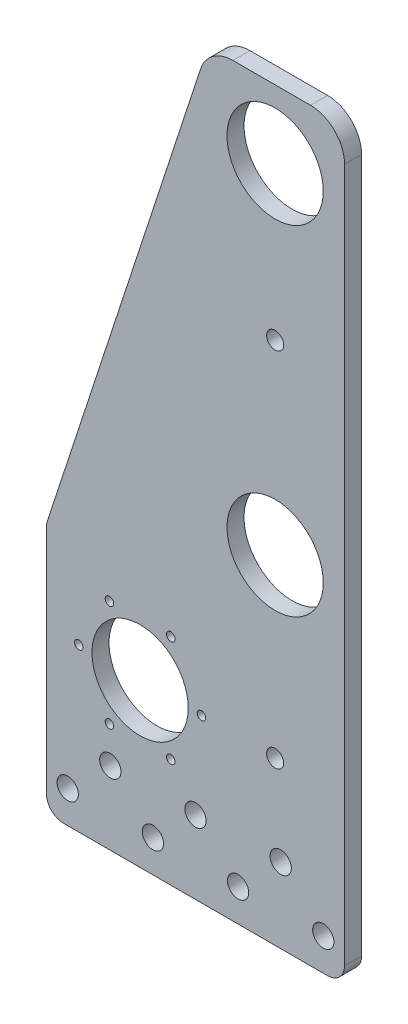
from build123d import *

# Parameters (mm, degrees)
SKETCH1_R           = 14.351
SKETCH1_R_2         = 2.54
SKETCH1_R_3         = 3.175
SKETCH1_R_4         = 1.27
BOSS_EXTRUDE1_DEPTH = 5.08


with BuildPart() as part:
    # Sketch1 → Boss-Extrude1 (new body)
    with BuildSketch(Plane.XY):
        with BuildLine():
            Line((88.9, 212.09), (88.9, 5.08))
            ThreePointArc((88.9, 5.08), (87.412102448, 1.487897552), (83.82, 0))
            Line((83.82, 0), (5.08, 0))
            ThreePointArc((5.08, 0), (1.487897552, 1.487897552), (0, 5.08))
            Line((0, 5.08), (0, 73.969993162))
            ThreePointArc((0, 73.969993162), (0.063384098, 74.769971217), (0.25195468, 75.549986324))
            Line((0.25195468, 75.549986324), (45.969223296, 215.249986324))
            ThreePointArc((45.969223296, 215.249986324), (49.662087504, 220.315906061), (55.625313935, 222.25))
            Line((55.625313935, 222.25), (78.74, 222.25))
            ThreePointArc((78.74, 222.25), (85.924204897, 219.274204897), (88.9, 212.09))
        make_face()
        with Locations((68.199, 201.93)):
            Circle(SKETCH1_R, mode=Mode.SUBTRACT)
        with Locations((68.199, 100.838)):
            Circle(SKETCH1_R, mode=Mode.SUBTRACT)
        with Locations((68.199, 156.30398)):
            Circle(SKETCH1_R_2, mode=Mode.SUBTRACT)
        with Locations((68.199, 48.35398)):
            Circle(SKETCH1_R_2, mode=Mode.SUBTRACT)
        with Locations((27.94, 48.35398)):
            Circle(SKETCH1_R, mode=Mode.SUBTRACT)
        with Locations((6.35, 9.652)):
            Circle(SKETCH1_R_3, mode=Mode.SUBTRACT)
        with Locations((31.75, 9.652)):
            Circle(SKETCH1_R_3, mode=Mode.SUBTRACT)
        with Locations((57.15, 9.652)):
            Circle(SKETCH1_R_3, mode=Mode.SUBTRACT)
        with Locations((82.55, 9.652)):
            Circle(SKETCH1_R_3, mode=Mode.SUBTRACT)
        with Locations((69.85, 22.352)):
            Circle(SKETCH1_R_3, mode=Mode.SUBTRACT)
        with Locations((44.45, 21.844)):
            Circle(SKETCH1_R_3, mode=Mode.SUBTRACT)
        with Locations((19.05, 21.844)):
            Circle(SKETCH1_R_3, mode=Mode.SUBTRACT)
        with Locations((46.228, 48.35398)):
            Circle(SKETCH1_R_4, mode=Mode.SUBTRACT)
        with Locations((37.084, 32.516107416)):
            Circle(SKETCH1_R_4, mode=Mode.SUBTRACT)
        with Locations((18.796, 32.516107416)):
            Circle(SKETCH1_R_4, mode=Mode.SUBTRACT)
        with Locations((9.652, 48.35398)):
            Circle(SKETCH1_R_4, mode=Mode.SUBTRACT)
        with Locations((18.796, 64.191852584)):
            Circle(SKETCH1_R_4, mode=Mode.SUBTRACT)
        with Locations((37.084, 64.191852584)):
            Circle(SKETCH1_R_4, mode=Mode.SUBTRACT)
    extrude(amount=BOSS_EXTRUDE1_DEPTH)


solid = part.part
